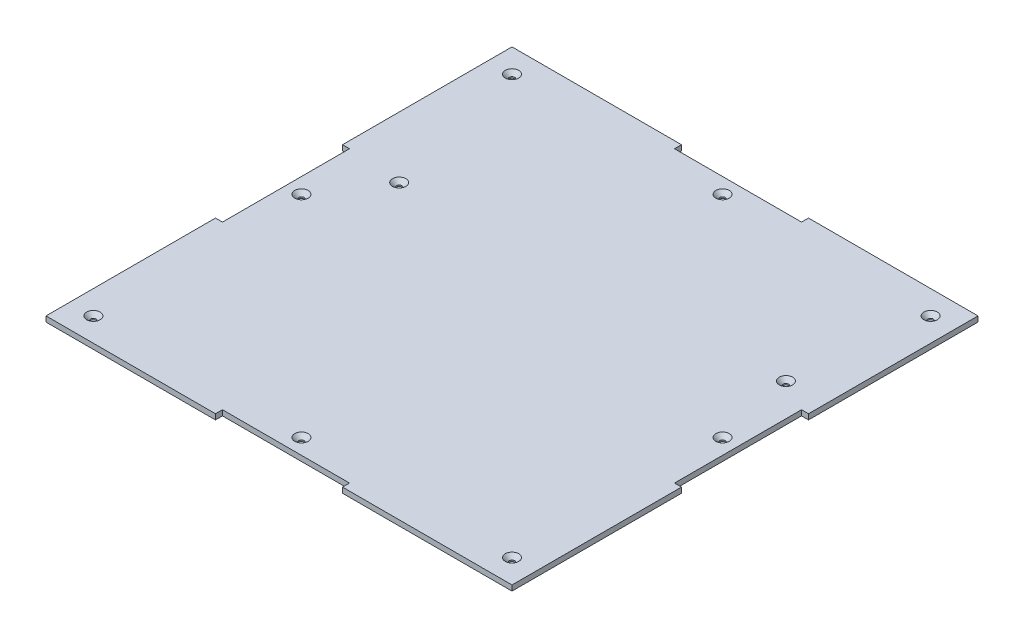
from build123d import *

# Parameters (mm, degrees)
BOSS_EXTRUDE1_DEPTH = 2
SKETCH2_R           = 1
CUT_EXTRUDE1_DEPTH  = 123.699327627
CHAMFER1_SIZE       = 1.5


with BuildPart() as part:
    # Sketch1 → Boss-Extrude1 (new body)
    with BuildSketch(Plane(origin=(0, 0, 0), x_dir=(1, 0, 0), z_dir=(0, 1, 0))):
        Polygon((23.65, -86.75), (86.75, -86.75), (86.75, -23.65), (84.15, -23.65), (84.15, 23.65), (86.75, 23.65), (86.75, 86.75), (23.65, 86.75), (23.65, 84.15), (-23.65, 84.15), (-23.65, 86.75), (-86.75, 86.75), (-86.75, 23.65), (-84.15, 23.65), (-84.15, -23.65), (-86.75, -23.65), (-86.75, -86.75), (-23.65, -86.75), (-23.65, -84.15), (23.65, -84.15), align=None)
    extrude(amount=BOSS_EXTRUDE1_DEPTH)

    # Sketch2 → Cut-Extrude1 (cut, through all)
    with BuildSketch(Plane.XZ):
        with Locations((-77.928932188, 77.928932188)):
            Circle(SKETCH2_R)
        with Locations((0, 78.4)):
            Circle(SKETCH2_R)
        with Locations((77.928932188, 77.928932188)):
            Circle(SKETCH2_R)
        with Locations((-78.4, 0)):
            Circle(SKETCH2_R)
        with Locations((78.4, 0)):
            Circle(SKETCH2_R)
        with Locations((72, -30)):
            Circle(SKETCH2_R)
        with Locations((-64, -22)):
            Circle(SKETCH2_R)
        with Locations((-77.928932188, -77.928932188)):
            Circle(SKETCH2_R)
        with Locations((0, -78.4)):
            Circle(SKETCH2_R)
        with Locations((77.928932188, -77.928932188)):
            Circle(SKETCH2_R)
    extrude(amount=-CUT_EXTRUDE1_DEPTH, mode=Mode.SUBTRACT)

    # Chamfer1
    chamfer1_edges = [part.edges().sort_by_distance(p)[0] for p in [
        (-78.928932188, 2, -77.928932188),
        (-1, 2, -78.4),
        (76.928932188, 2, -77.928932188),
        (71, 2, -30),
        (77.4, 2, 0),
        (-65, 2, -22),
        (-79.4, 2, 0),
        (-78.928932188, 2, 77.928932188),
        (-1, 2, 78.4),
        (76.928932188, 2, 77.928932188),
    ]]
    chamfer(chamfer1_edges, length=CHAMFER1_SIZE)


solid = part.part
